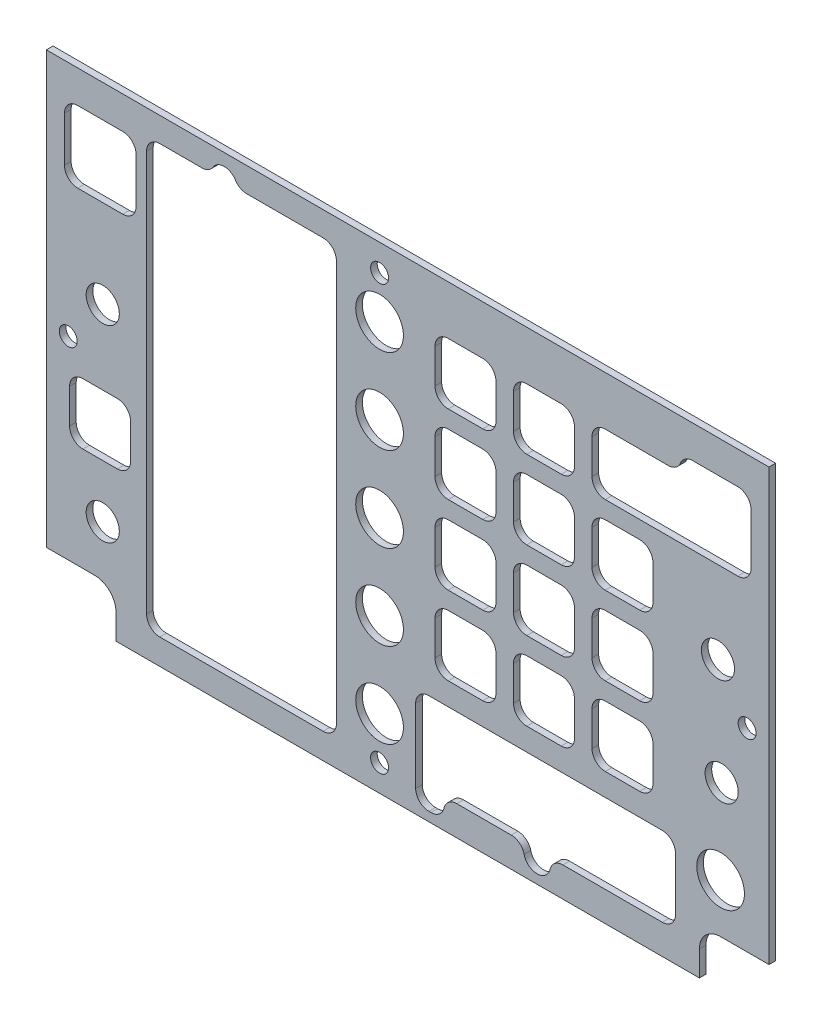
from build123d import *

# Parameters (mm, degrees)
BOSS_EXTRUDE1_DEPTH     = 1.5875
SKETCH4_R               = 3.96875
CUT_EXTRUDE2_DEPTH      = 202.731272774
F_6_CLEARANCE_HOLE2_D   = 4.3053
CUT_EXTRUDE8_DEPTH      = 202.731272774
CUT_EXTRUDE8_DEPTH_BACK = 202.731272774
SKETCH15_R              = 5.715


with BuildPart() as part:
    # Sketch1 → Boss-Extrude1 (new body)
    with BuildSketch(Plane.XY):
        with BuildLine():
            Line((74.93, -171.1167297), (86.51875, -171.1167297))
            Line((86.51875, -171.1167297), (86.51875, -67.9292297))
            Line((86.51875, -67.9292297), (-86.51875, -67.9292297))
            Line((-86.51875, -67.9292297), (-86.51875, -171.1167297))
            Line((-86.51875, -171.1167297), (-74.93, -171.1167297))
            ThreePointArc((-74.93, -171.1167297), (-71.337897552, -172.604627251), (-69.85, -176.1967297))
            Line((-69.85, -176.1967297), (-69.85, -182.2292297))
            Line((-69.85, -182.2292297), (69.85, -182.2292297))
            Line((69.85, -182.2292297), (69.85, -176.1967297))
            ThreePointArc((69.85, -176.1967297), (71.337897552, -172.604627251), (74.93, -171.1167297))
        make_face()
    extrude(amount=-BOSS_EXTRUDE1_DEPTH)

    # Sketch4 → Cut-Extrude2 (cut, through all)
    with BuildSketch(Plane.XY):
        with Locations((-73.025, -113.9667297)):
            Circle(SKETCH4_R)
        with Locations((-73.025, -159.0517297)):
            Circle(SKETCH4_R)
        with Locations((74.295, -113.9667297)):
            Circle(SKETCH4_R)
        with Locations((75.184, -139.0492297)):
            Circle(SKETCH4_R)
    extrude(amount=-CUT_EXTRUDE2_DEPTH, mode=Mode.SUBTRACT)

    # #6 Clearance Hole2 (through all)
    with Locations(Plane(origin=(0, 0, 1.5875), x_dir=(-1, 0, 0), z_dir=(0, 0, 1))):
        with Locations((-81.28, 124.6982297), (6.731, 175.8792297), (81.28, 124.6982297), (6.731, 74.2792297)):
            Hole(F_6_CLEARANCE_HOLE2_D / 2)

    # Sketch15 → Cut-Extrude8 (cut, two sides: drawn at the far end of the back side and taken through both)
    with BuildSketch(Plane(origin=(0, 0, -1.5875), x_dir=(-1, 0, 0), z_dir=(0, 0, -1)).offset(-CUT_EXTRUDE8_DEPTH_BACK)):
        with Locations((-74.93, -159.3692297)):
            Circle(SKETCH15_R)
        with Locations((6.731, -84.4392297)):
            Circle(SKETCH15_R)
        with Locations((6.731, -104.7592297)):
            Circle(SKETCH15_R)
        with Locations((6.731, -125.0792297)):
            Circle(SKETCH15_R)
        with Locations((6.731, -145.3992297)):
            Circle(SKETCH15_R)
        with Locations((6.731, -165.7192297)):
            Circle(SKETCH15_R)
        with BuildLine():
            Line((-58.7375, -139.2397297), (-58.7375, -147.4947297))
            ThreePointArc((-58.7375, -147.4947297), (-57.80756403, -149.73979373), (-55.5625, -150.6697297))
            Line((-55.5625, -150.6697297), (-47.3075, -150.6697297))
            ThreePointArc((-47.3075, -150.6697297), (-45.06243597, -149.73979373), (-44.1325, -147.4947297))
            Line((-44.1325, -147.4947297), (-44.1325, -139.2397297))
            ThreePointArc((-44.1325, -139.2397297), (-45.06243597, -136.99466567), (-47.3075, -136.0647297))
            Line((-47.3075, -136.0647297), (-55.5625, -136.0647297))
            ThreePointArc((-55.5625, -136.0647297), (-57.80756403, -136.99466567), (-58.7375, -139.2397297))
        make_face()
        with BuildLine():
            Line((-58.7375, -120.4437297), (-58.7375, -128.6987297))
            ThreePointArc((-58.7375, -128.6987297), (-57.80756403, -130.94379373), (-55.5625, -131.8737297))
            Line((-55.5625, -131.8737297), (-47.3075, -131.8737297))
            ThreePointArc((-47.3075, -131.8737297), (-45.06243597, -130.94379373), (-44.1325, -128.6987297))
            Line((-44.1325, -128.6987297), (-44.1325, -120.4437297))
            ThreePointArc((-44.1325, -120.4437297), (-45.06243597, -118.19866567), (-47.3075, -117.2687297))
            Line((-47.3075, -117.2687297), (-55.5625, -117.2687297))
            ThreePointArc((-55.5625, -117.2687297), (-57.80756403, -118.19866567), (-58.7375, -120.4437297))
        make_face()
        with BuildLine():
            Line((-58.7375, -101.6477297), (-58.7375, -109.9027297))
            ThreePointArc((-58.7375, -109.9027297), (-57.80756403, -112.14779373), (-55.5625, -113.0777297))
            Line((-55.5625, -113.0777297), (-47.3075, -113.0777297))
            ThreePointArc((-47.3075, -113.0777297), (-45.06243597, -112.14779373), (-44.1325, -109.9027297))
            Line((-44.1325, -109.9027297), (-44.1325, -101.6477297))
            ThreePointArc((-44.1325, -101.6477297), (-45.06243597, -99.40266567), (-47.3075, -98.4727297))
            Line((-47.3075, -98.4727297), (-55.5625, -98.4727297))
            ThreePointArc((-55.5625, -98.4727297), (-57.80756403, -99.40266567), (-58.7375, -101.6477297))
        make_face()
        with BuildLine():
            Line((-47.3075, -79.6767297), (-62.377050713, -79.6767297))
            ThreePointArc((-62.377050713, -79.6767297), (-64.144815899, -79.139082776), (-65.313882808, -77.7082297))
            ThreePointArc((-65.313882808, -77.7082297), (-66.482949717, -76.277376623), (-68.250714902, -75.7397297))
            Line((-68.250714902, -75.7397297), (-79.045714902, -75.7397297))
            ThreePointArc((-79.045714902, -75.7397297), (-81.290778932, -76.66966567), (-82.220714902, -78.9147297))
            Line((-82.220714902, -78.9147297), (-82.220714902, -91.1067297))
            ThreePointArc((-82.220714902, -91.1067297), (-81.290778932, -93.35179373), (-79.045714902, -94.2817297))
            Line((-79.045714902, -94.2817297), (-47.3075, -94.2817297))
            ThreePointArc((-47.3075, -94.2817297), (-45.06243597, -93.35179373), (-44.1325, -91.1067297))
            Line((-44.1325, -91.1067297), (-44.1325, -82.8517297))
            ThreePointArc((-44.1325, -82.8517297), (-45.06243597, -80.60666567), (-47.3075, -79.6767297))
        make_face()
        with BuildLine():
            Line((-39.9415, -82.8517297), (-39.9415, -91.1067297))
            ThreePointArc((-39.9415, -91.1067297), (-39.01156403, -93.35179373), (-36.7665, -94.2817297))
            Line((-36.7665, -94.2817297), (-28.5115, -94.2817297))
            ThreePointArc((-28.5115, -94.2817297), (-26.26643597, -93.35179373), (-25.3365, -91.1067297))
            Line((-25.3365, -91.1067297), (-25.3365, -82.8517297))
            ThreePointArc((-25.3365, -82.8517297), (-26.26643597, -80.60666567), (-28.5115, -79.6767297))
            Line((-28.5115, -79.6767297), (-36.7665, -79.6767297))
            ThreePointArc((-36.7665, -79.6767297), (-39.01156403, -80.60666567), (-39.9415, -82.8517297))
        make_face()
        with BuildLine():
            Line((-39.9415, -101.6477297), (-39.9415, -109.9027297))
            ThreePointArc((-39.9415, -109.9027297), (-39.01156403, -112.14779373), (-36.7665, -113.0777297))
            Line((-36.7665, -113.0777297), (-28.5115, -113.0777297))
            ThreePointArc((-28.5115, -113.0777297), (-26.26643597, -112.14779373), (-25.3365, -109.9027297))
            Line((-25.3365, -109.9027297), (-25.3365, -101.6477297))
            ThreePointArc((-25.3365, -101.6477297), (-26.26643597, -99.40266567), (-28.5115, -98.4727297))
            Line((-28.5115, -98.4727297), (-36.7665, -98.4727297))
            ThreePointArc((-36.7665, -98.4727297), (-39.01156403, -99.40266567), (-39.9415, -101.6477297))
        make_face()
        with BuildLine():
            Line((-39.9415, -120.4437297), (-39.9415, -128.6987297))
            ThreePointArc((-39.9415, -128.6987297), (-39.01156403, -130.94379373), (-36.7665, -131.8737297))
            Line((-36.7665, -131.8737297), (-28.5115, -131.8737297))
            ThreePointArc((-28.5115, -131.8737297), (-26.26643597, -130.94379373), (-25.3365, -128.6987297))
            Line((-25.3365, -128.6987297), (-25.3365, -120.4437297))
            ThreePointArc((-25.3365, -120.4437297), (-26.26643597, -118.19866567), (-28.5115, -117.2687297))
            Line((-28.5115, -117.2687297), (-36.7665, -117.2687297))
            ThreePointArc((-36.7665, -117.2687297), (-39.01156403, -118.19866567), (-39.9415, -120.4437297))
        make_face()
        with BuildLine():
            Line((-39.9415, -139.2397297), (-39.9415, -147.4947297))
            ThreePointArc((-39.9415, -147.4947297), (-39.01156403, -149.73979373), (-36.7665, -150.6697297))
            Line((-36.7665, -150.6697297), (-28.5115, -150.6697297))
            ThreePointArc((-28.5115, -150.6697297), (-26.26643597, -149.73979373), (-25.3365, -147.4947297))
            Line((-25.3365, -147.4947297), (-25.3365, -139.2397297))
            ThreePointArc((-25.3365, -139.2397297), (-26.26643597, -136.99466567), (-28.5115, -136.0647297))
            Line((-28.5115, -136.0647297), (-36.7665, -136.0647297))
            ThreePointArc((-36.7665, -136.0647297), (-39.01156403, -136.99466567), (-39.9415, -139.2397297))
        make_face()
        with BuildLine():
            Line((-24.800349283, -175.1172297), (-11.779650717, -175.1172297))
            ThreePointArc((-11.779650717, -175.1172297), (-9.801071682, -175.809116734), (-8.684825359, -177.5832297))
            ThreePointArc((-8.684825359, -177.5832297), (-7.568579036, -179.357342665), (-5.59, -180.0492297))
            Line((-5.59, -180.0492297), (-5.08, -180.0492297))
            ThreePointArc((-5.08, -180.0492297), (-2.83493597, -179.11929373), (-1.905, -176.8742297))
            Line((-1.905, -176.8742297), (-1.905, -159.2422297))
            ThreePointArc((-1.905, -159.2422297), (-2.83493597, -156.99716567), (-5.08, -156.0672297))
            Line((-5.08, -156.0672297), (-60.96, -156.0672297))
            ThreePointArc((-60.96, -156.0672297), (-63.20506403, -156.99716567), (-64.135, -159.2422297))
            Line((-64.135, -159.2422297), (-64.135, -171.9422297))
            ThreePointArc((-64.135, -171.9422297), (-63.20506403, -174.18729373), (-60.96, -175.1172297))
            Line((-60.96, -175.1172297), (-37.179650717, -175.1172297))
            ThreePointArc((-37.179650717, -175.1172297), (-35.201071682, -175.809116734), (-34.084825359, -177.5832297))
            ThreePointArc((-34.084825359, -177.5832297), (-30.99, -180.0492297), (-27.895174641, -177.5832297))
            ThreePointArc((-27.895174641, -177.5832297), (-26.778928318, -175.809116734), (-24.800349283, -175.1172297))
        make_face()
        with BuildLine():
            Line((-6.5405, -147.4947297), (-6.5405, -139.2397297))
            ThreePointArc((-6.5405, -139.2397297), (-7.47043597, -136.99466567), (-9.7155, -136.0647297))
            Line((-9.7155, -136.0647297), (-17.9705, -136.0647297))
            ThreePointArc((-17.9705, -136.0647297), (-20.21556403, -136.99466567), (-21.1455, -139.2397297))
            Line((-21.1455, -139.2397297), (-21.1455, -147.4947297))
            ThreePointArc((-21.1455, -147.4947297), (-20.21556403, -149.73979373), (-17.9705, -150.6697297))
            Line((-17.9705, -150.6697297), (-9.7155, -150.6697297))
            ThreePointArc((-9.7155, -150.6697297), (-7.47043597, -149.73979373), (-6.5405, -147.4947297))
        make_face()
        with BuildLine():
            Line((-6.5405, -128.6987297), (-6.5405, -120.4437297))
            ThreePointArc((-6.5405, -120.4437297), (-7.47043597, -118.19866567), (-9.7155, -117.2687297))
            Line((-9.7155, -117.2687297), (-17.9705, -117.2687297))
            ThreePointArc((-17.9705, -117.2687297), (-20.21556403, -118.19866567), (-21.1455, -120.4437297))
            Line((-21.1455, -120.4437297), (-21.1455, -128.6987297))
            ThreePointArc((-21.1455, -128.6987297), (-20.21556403, -130.94379373), (-17.9705, -131.8737297))
            Line((-17.9705, -131.8737297), (-9.7155, -131.8737297))
            ThreePointArc((-9.7155, -131.8737297), (-7.47043597, -130.94379373), (-6.5405, -128.6987297))
        make_face()
        with BuildLine():
            Line((-21.1455, -101.6477297), (-21.1455, -109.9027297))
            ThreePointArc((-21.1455, -109.9027297), (-20.21556403, -112.14779373), (-17.9705, -113.0777297))
            Line((-17.9705, -113.0777297), (-9.7155, -113.0777297))
            ThreePointArc((-9.7155, -113.0777297), (-7.47043597, -112.14779373), (-6.5405, -109.9027297))
            Line((-6.5405, -109.9027297), (-6.5405, -101.6477297))
            ThreePointArc((-6.5405, -101.6477297), (-7.47043597, -99.40266567), (-9.7155, -98.4727297))
            Line((-9.7155, -98.4727297), (-17.9705, -98.4727297))
            ThreePointArc((-17.9705, -98.4727297), (-20.21556403, -99.40266567), (-21.1455, -101.6477297))
        make_face()
        with BuildLine():
            Line((-21.1455, -82.8517297), (-21.1455, -91.1067297))
            ThreePointArc((-21.1455, -91.1067297), (-20.21556403, -93.35179373), (-17.9705, -94.2817297))
            Line((-17.9705, -94.2817297), (-9.7155, -94.2817297))
            ThreePointArc((-9.7155, -94.2817297), (-7.47043597, -93.35179373), (-6.5405, -91.1067297))
            Line((-6.5405, -91.1067297), (-6.5405, -82.8517297))
            ThreePointArc((-6.5405, -82.8517297), (-7.47043597, -80.60666567), (-9.7155, -79.6767297))
            Line((-9.7155, -79.6767297), (-17.9705, -79.6767297))
            ThreePointArc((-17.9705, -79.6767297), (-20.21556403, -80.60666567), (-21.1455, -82.8517297))
        make_face()
        with BuildLine():
            Line((38.568712352, -73.7922297), (20.243, -73.7922297))
            ThreePointArc((20.243, -73.7922297), (17.99793597, -74.72216567), (17.068, -76.9672297))
            Line((17.068, -76.9672297), (17.068, -172.9372297))
            ThreePointArc((17.068, -172.9372297), (17.99793597, -175.18229373), (20.243, -176.1122297))
            Line((20.243, -176.1122297), (59.355, -176.1122297))
            ThreePointArc((59.355, -176.1122297), (61.60006403, -175.18229373), (62.53, -172.9372297))
            Line((62.53, -172.9372297), (62.53, -76.9672297))
            ThreePointArc((62.53, -76.9672297), (61.60006403, -74.72216567), (59.355, -73.7922297))
            Line((59.355, -73.7922297), (49.311287648, -73.7922297))
            ThreePointArc((49.311287648, -73.7922297), (47.777703203, -73.397291525), (46.625643824, -72.3107297))
            ThreePointArc((46.625643824, -72.3107297), (43.94, -70.8292297), (41.254356176, -72.3107297))
            ThreePointArc((41.254356176, -72.3107297), (40.102296797, -73.397291525), (38.568712352, -73.7922297))
        make_face()
        with BuildLine():
            Line((65.040037257, -78.898207272), (65.040037257, -89.693207272))
            ThreePointArc((65.040037257, -89.693207272), (65.969973227, -91.938271303), (68.215037257, -92.868207272))
            Line((68.215037257, -92.868207272), (79.010037257, -92.868207272))
            ThreePointArc((79.010037257, -92.868207272), (81.255101288, -91.938271303), (82.185037257, -89.693207272))
            Line((82.185037257, -89.693207272), (82.185037257, -78.898207272))
            ThreePointArc((82.185037257, -78.898207272), (81.255101288, -76.653143242), (79.010037257, -75.723207272))
            Line((79.010037257, -75.723207272), (68.215037257, -75.723207272))
            ThreePointArc((68.215037257, -75.723207272), (65.969973227, -76.653143242), (65.040037257, -78.898207272))
        make_face()
        with BuildLine():
            Line((80.9625, -143.1767297), (80.9625, -134.9217297))
            ThreePointArc((80.9625, -134.9217297), (80.03256403, -132.67666567), (77.7875, -131.7467297))
            Line((77.7875, -131.7467297), (69.5325, -131.7467297))
            ThreePointArc((69.5325, -131.7467297), (67.28743597, -132.67666567), (66.3575, -134.9217297))
            Line((66.3575, -134.9217297), (66.3575, -143.1767297))
            ThreePointArc((66.3575, -143.1767297), (67.28743597, -145.42179373), (69.5325, -146.3517297))
            Line((69.5325, -146.3517297), (77.7875, -146.3517297))
            ThreePointArc((77.7875, -146.3517297), (80.03256403, -145.42179373), (80.9625, -143.1767297))
        make_face()
    extrude(amount=CUT_EXTRUDE8_DEPTH + CUT_EXTRUDE8_DEPTH_BACK, mode=Mode.SUBTRACT)


solid = part.part
